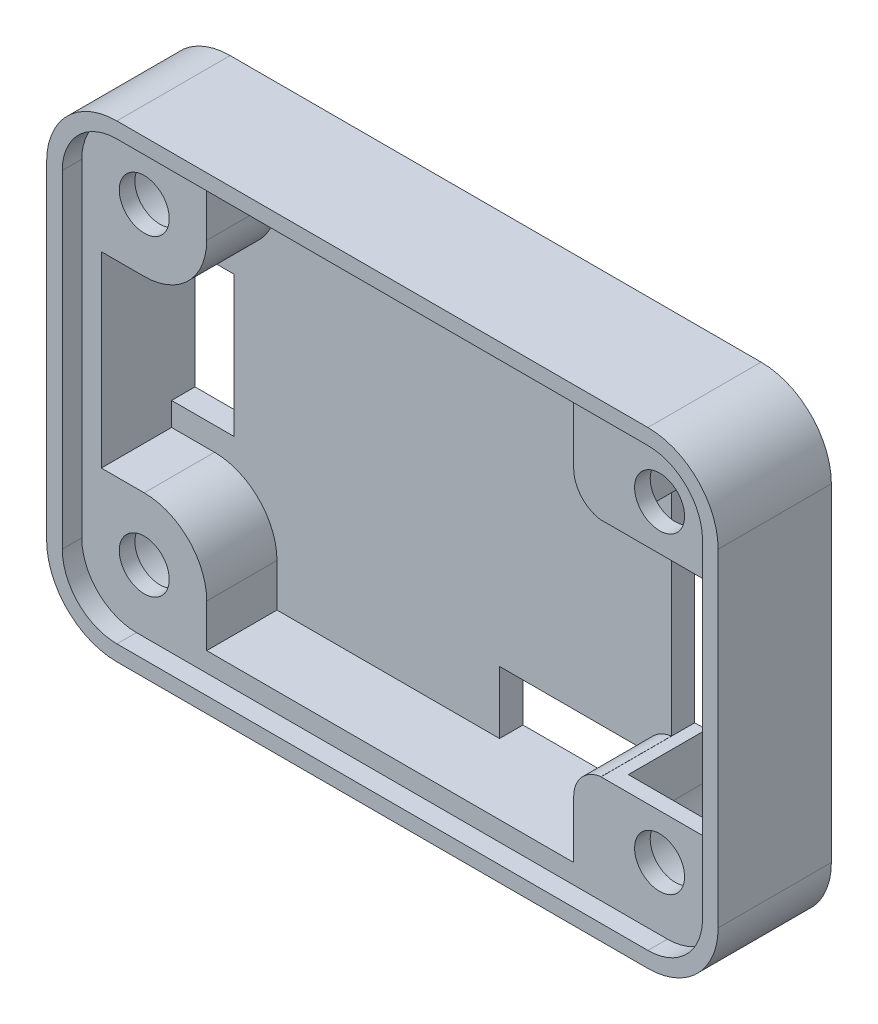
from build123d import *

# Parameters (mm, degrees)
EXTRUDE_1_DEPTH     = 6
CUT_EXTRUDE_1_DEPTH = 4.5
EXTRUDE_4_DEPTH     = 4.5
SKETCH_4_R          = 1.6
CUT_EXTRUDE_2_DEPTH = 6
EXTRUDE_5_DEPTH     = 1.25
CUT_EXTRUDE_START   = -5
SKETCH_6_R          = 1.6
SKETCH_6_R_2        = 3
CUT_EXTRUDE_3_DEPTH = 5
SKETCH_7_W          = 6.5
SKETCH_7_H          = 14.25
SKETCH_7_W_2        = 4
SKETCH_7_H_2        = 9
SKETCH_7_W_3        = 9
SKETCH_7_H_3        = 4
CUT_EXTRUDE_4_DEPTH = 8


with BuildPart() as part:
    # Эскиз1 → Бобышка-Вытянуть1 (new body)
    with BuildSketch(Plane.XY):
        with BuildLine():
            Line((-17, -15), (17, -15))
            ThreePointArc((17, -15), (20.181980515, -13.681980515), (21.5, -10.5))
            Line((21.5, -10.5), (21.5, 10.5))
            ThreePointArc((21.5, 10.5), (20.181980515, 13.681980515), (17, 15))
            Line((17, 15), (-17, 15))
            ThreePointArc((-17, 15), (-20.181980515, 13.681980515), (-21.5, 10.5))
            Line((-21.5, 10.5), (-21.5, -10.5))
            ThreePointArc((-21.5, -10.5), (-20.181980515, -13.681980515), (-17, -15))
        make_face()
    extrude(amount=EXTRUDE_1_DEPTH)

    # Эскиз2 → Вырез-Вытянуть1 (cut)
    with BuildSketch(Plane.XY.offset(6)):
        with BuildLine():
            Line((-17, -12.75), (17, -12.75))
            ThreePointArc((17, -12.75), (18.590990258, -12.090990258), (19.25, -10.5))
            Line((19.25, -10.5), (19.25, 10.5))
            ThreePointArc((19.25, 10.5), (18.590990258, 12.090990258), (17, 12.75))
            Line((17, 12.75), (-17, 12.75))
            ThreePointArc((-17, 12.75), (-18.590990258, 12.090990258), (-19.25, 10.5))
            Line((-19.25, 10.5), (-19.25, -10.5))
            ThreePointArc((-19.25, -10.5), (-18.590990258, -12.090990258), (-17, -12.75))
        make_face()
    extrude(amount=-CUT_EXTRUDE_1_DEPTH, mode=Mode.SUBTRACT)

    # Эскиз3 → Бобышка-Вытянуть4 (add)
    with BuildSketch(Plane.XY.offset(1.5)):
        with BuildLine():
            Line((-12.5, 10), (-12.5, 14))
            Line((-12.5, 14), (-17.5, 14))
            ThreePointArc((-17.5, 14), (-19.621320344, 13.121320344), (-20.5, 11))
            Line((-20.5, 11), (-20.5, 6))
            Line((-20.5, 6), (-16.5, 6))
            ThreePointArc((-16.5, 6), (-13.671572875, 7.171572875), (-12.5, 10))
        make_face()
        with BuildLine():
            Line((11, -10), (11, -9.1))
            ThreePointArc((11, -9.1), (11.585786438, -7.685786438), (13, -7.1))
            Line((13, -7.1), (16.5, -7.1))
            Line((16.5, -7.1), (20.5, -7.1))
            Line((20.5, -7.1), (20.5, -11))
            ThreePointArc((20.5, -11), (19.621320344, -13.121320344), (17.5, -14))
            Line((17.5, -14), (11, -14))
            Line((11, -14), (11, -10))
        make_face()
        with BuildLine():
            Line((-16.5, -6), (-20.5, -6))
            Line((-20.5, -6), (-20.5, -11))
            ThreePointArc((-20.5, -11), (-19.621320344, -13.121320344), (-17.5, -14))
            Line((-17.5, -14), (-12.5, -14))
            Line((-12.5, -14), (-12.5, -10))
            ThreePointArc((-12.5, -10), (-13.671572875, -7.171572875), (-16.5, -6))
        make_face()
        with BuildLine():
            Line((11, 10), (11, 9.1))
            ThreePointArc((11, 9.1), (11.585786438, 7.685786438), (13, 7.1))
            Line((13, 7.1), (16.5, 7.1))
            Line((16.5, 7.1), (20.5, 7.1))
            Line((20.5, 7.1), (20.5, 11))
            ThreePointArc((20.5, 11), (19.621320344, 13.121320344), (17.5, 14))
            Line((17.5, 14), (11, 14))
            Line((11, 14), (11, 10))
        make_face()
    extrude(amount=EXTRUDE_4_DEPTH)

    # Эскиз4 → Вырез-Вытянуть2 (cut)
    with BuildSketch(Plane.XY.offset(6)):
        with Locations((16.5, -10)):
            Circle(SKETCH_4_R)
        with Locations((-16.5, -10)):
            Circle(SKETCH_4_R)
        with Locations((-16.5, 10)):
            Circle(SKETCH_4_R)
        with Locations((16.5, 10)):
            Circle(SKETCH_4_R)
    extrude(amount=-CUT_EXTRUDE_2_DEPTH, mode=Mode.SUBTRACT)

    # Эскиз5 → Бобышка-Вытянуть5 (add)
    with BuildSketch(Plane.XY.offset(6)):
        with BuildLine():
            Line((17, -15), (-17, -15))
            ThreePointArc((-17, -15), (-20.181980515, -13.681980515), (-21.5, -10.5))
            Line((-21.5, -10.5), (-21.5, 10.5))
            ThreePointArc((-21.5, 10.5), (-20.181980515, 13.681980515), (-17, 15))
            Line((-17, 15), (17, 15))
            ThreePointArc((17, 15), (20.181980515, 13.681980515), (21.5, 10.5))
            Line((21.5, 10.5), (21.5, -10.5))
            ThreePointArc((21.5, -10.5), (20.181980515, -13.681980515), (17, -15))
        make_face()
        with BuildLine():
            Line((17, -14), (-17, -14))
            ThreePointArc((-17, -14), (-19.474873734, -12.974873734), (-20.5, -10.5))
            Line((-20.5, -10.5), (-20.5, 10.5))
            ThreePointArc((-20.5, 10.5), (-19.474873734, 12.974873734), (-17, 14))
            Line((-17, 14), (17, 14))
            ThreePointArc((17, 14), (19.474873734, 12.974873734), (20.5, 10.5))
            Line((20.5, 10.5), (20.5, -10.5))
            ThreePointArc((20.5, -10.5), (19.474873734, -12.974873734), (17, -14))
        make_face(mode=Mode.SUBTRACT)
    extrude(amount=EXTRUDE_5_DEPTH)

    # Эскиз6 → Вырез-Вытянуть3 (cut)
    # profile 1 of 3: a face of its own
    with BuildSketch(Plane(origin=(0, 0, 0), x_dir=(-1, 0, 0), z_dir=(0, 0, -1)).offset(CUT_EXTRUDE_START)):
        with BuildLine():
            ThreePointArc((-13.5, 10), (-16.5, 13), (-19.5, 10))
            Line((-19.5, 10), (-19.5, -10))
            ThreePointArc((-19.5, -10), (-16.5, -13), (-13.5, -10))
            Line((-13.5, -10), (-13.5, 10))
        make_face()
        with Locations((-16.5, 10)):
            Circle(SKETCH_6_R, mode=Mode.SUBTRACT)
        with Locations((-16.5, -10)):
            Circle(SKETCH_6_R, mode=Mode.SUBTRACT)
    # profile 2 of 3: a face of its own
    with BuildSketch(Plane(origin=(0, 0, 0), x_dir=(-1, 0, 0), z_dir=(0, 0, -1)).offset(CUT_EXTRUDE_START)):
        with Locations((16.5, -10)):
            Circle(SKETCH_6_R_2)
        with Locations((16.5, -10)):
            Circle(SKETCH_6_R, mode=Mode.SUBTRACT)
    # profile 3 of 3: a face of its own
    with BuildSketch(Plane(origin=(0, 0, 0), x_dir=(-1, 0, 0), z_dir=(0, 0, -1)).offset(CUT_EXTRUDE_START)):
        with Locations((16.5, 10)):
            Circle(SKETCH_6_R_2)
        with Locations((16.5, 10)):
            Circle(SKETCH_6_R, mode=Mode.SUBTRACT)
    extrude(amount=CUT_EXTRUDE_3_DEPTH, mode=Mode.SUBTRACT)

    # Эскиз7 → Вырез-Вытянуть4 (cut)
    with BuildSketch(Plane(origin=(0, 0, 0), x_dir=(-1, 0, 0), z_dir=(0, 0, -1))):
        with Locations((-16, 0)):
            Rectangle(SKETCH_7_W, SKETCH_7_H)
        with Locations((17.25, 0)):
            Rectangle(SKETCH_7_W_2, SKETCH_7_H_2)
        with Locations((-6.25, -10.75)):
            Rectangle(SKETCH_7_W_3, SKETCH_7_H_3)
    extrude(amount=-CUT_EXTRUDE_4_DEPTH, mode=Mode.SUBTRACT)


solid = part.part
